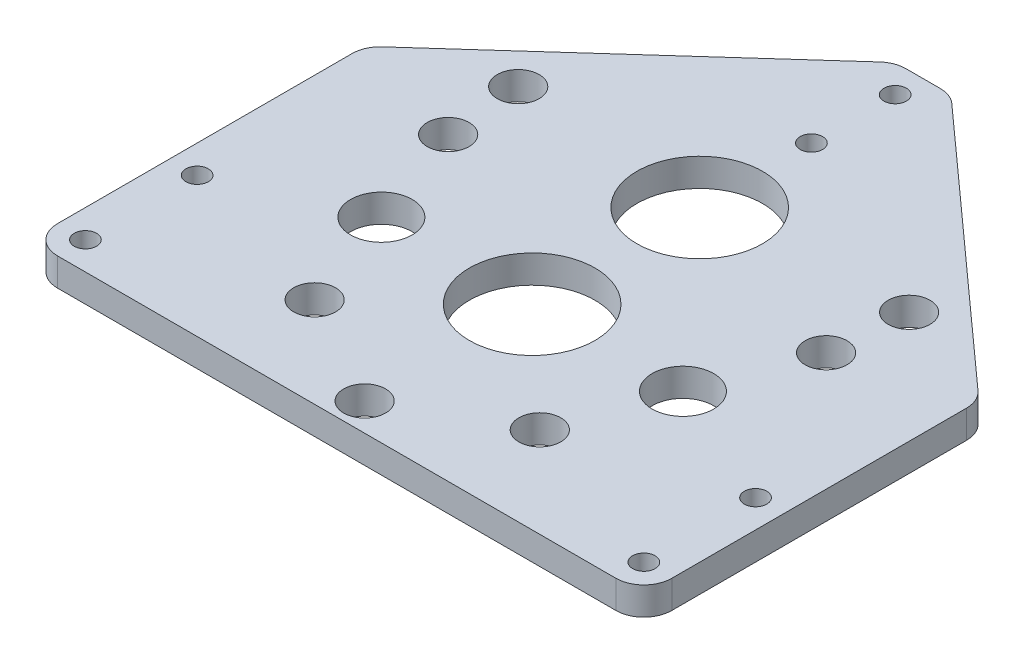
from build123d import *

# Parameters (mm, degrees)
BOSS_EXTRUDE1_DEPTH        = 6.35
SKETCH2_R                  = 7
MOTOR_BEARING_HOLES_DEPTH  = 135.10382172
SKETCH3_R                  = 14.2875
CUT_EXTRUDE1_DEPTH         = 135.10382172
SKETCH4_R                  = 14.2875
CUT_EXTRUDE2_DEPTH         = 135.10382172
SKETCH5_R                  = 4.7625
CUT_EXTRUDE3_DEPTH         = 50.8
F_10_CLEARANCE_HOLE1_D     = 5.1054
F_10_CLEARANCE_HOLE2_D     = 5.1054
F_10_CLEARANCE_HOLE2_DEPTH = 50.8
F_10_CLEARANCE_HOLE2_TIP   = 1.533816902
FILLET1_R                  = 6.35
SKETCH10_R                 = 4.7625
CUT_EXTRUDE4_DEPTH         = 50.8


with BuildPart() as part:
    # Sketch1 → Boss-Extrude1 (new body)
    with BuildSketch(Plane(origin=(0, 0, 0), x_dir=(1, 0, 0), z_dir=(0, 1, 0))):
        Polygon((-69.85, -19.05), (69.85, -19.05), (69.85, 57.15), (6.35, 114.3), (-6.35, 114.3), (-69.85, 57.15), align=None)
    extrude(amount=BOSS_EXTRUDE1_DEPTH)

    # Sketch2 → Motor Bearing Holes (cut, through all)
    with BuildSketch(Plane(origin=(0, 6.35, 0), x_dir=(1, 0, 0), z_dir=(0, 1, 0))):
        with Locations((-34.29, 25.4)):
            Circle(SKETCH2_R)
        with Locations((34.29, 25.4)):
            Circle(SKETCH2_R)
    extrude(amount=-MOTOR_BEARING_HOLES_DEPTH, mode=Mode.SUBTRACT)

    # Sketch3 → Cut-Extrude1 (cut, through all)
    with BuildSketch(Plane(origin=(0, 6.35, 0), x_dir=(1, 0, 0), z_dir=(0, 1, 0))):
        with Locations((0, 25.4)):
            Circle(SKETCH3_R)
    extrude(amount=-CUT_EXTRUDE1_DEPTH, mode=Mode.SUBTRACT)

    # Sketch4 → Cut-Extrude2 (cut, through all)
    with BuildSketch(Plane(origin=(0, 6.35, 0), x_dir=(1, 0, 0), z_dir=(0, 1, 0))):
        with Locations((0, 63.5)):
            Circle(SKETCH4_R)
    extrude(amount=-CUT_EXTRUDE2_DEPTH, mode=Mode.SUBTRACT)

    # Sketch5 → Cut-Extrude3 (cut)
    with BuildSketch(Plane(origin=(0, 38.1, 19.05), x_dir=(-0.9584281674521108, 0, 0.2853339233851958), z_dir=(0, 1, 0))):
        with Locations((21.697168114, -77.740965053)):
            Circle(SKETCH5_R)
        with Locations((18.665649821, -27.031499499)):
            Circle(SKETCH5_R)
        with Locations((-30.411025551, -12.420868461)):
            Circle(SKETCH5_R)
        with Locations((-60.684163962, -53.21519516)):
            Circle(SKETCH5_R)
    extrude(amount=-CUT_EXTRUDE3_DEPTH, mode=Mode.SUBTRACT)

    # #10 Clearance Hole1 (through all)
    with Locations(Plane(origin=(0, 6.35, 19.05), x_dir=(1, 0, 0), z_dir=(0, 1, 0))):
        with Locations((-63.5, 6.35), (63.5, 6.35), (0, 107.95)):
            Hole(F_10_CLEARANCE_HOLE1_D / 2)

    # #10 Clearance Hole2
    with Locations(Plane(origin=(0, 38.1, 19.05), x_dir=(1, 0, 0), z_dir=(0, 1, 0))):
        with Locations((-63.5, 31.75), (63.5, 31.75), (0, 127)):
            Hole(F_10_CLEARANCE_HOLE2_D / 2, depth=F_10_CLEARANCE_HOLE2_DEPTH)
            with Locations((0, 0, -(F_10_CLEARANCE_HOLE2_DEPTH + F_10_CLEARANCE_HOLE2_TIP / 2))):  # 118° drill point
                Cone(0, F_10_CLEARANCE_HOLE2_D / 2, F_10_CLEARANCE_HOLE2_TIP, mode=Mode.SUBTRACT)

    # Fillet1
    fillet1_edges = [part.edges().sort_by_distance(p)[0] for p in [
        (-6.35, 3.175, -114.3),
        (6.35, 3.175, -114.3),
        (69.85, 3.175, -57.15),
        (69.85, 3.175, 19.05),
        (-69.85, 3.175, -57.15),
        (-69.85, 3.175, 19.05),
    ]]
    fillet(fillet1_edges, radius=FILLET1_R)

    # Sketch10 → Cut-Extrude4 (cut)
    with BuildSketch(Plane(origin=(0, -28.575, 19.05), x_dir=(-1, 0, 0), z_dir=(0, -1, 0))):
        with Locations((-44.45, 85.725)):
            Circle(SKETCH10_R)
        with Locations((44.45, 85.725)):
            Circle(SKETCH10_R)
        with Locations((0, 6.35)):
            Circle(SKETCH10_R)
    extrude(amount=-CUT_EXTRUDE4_DEPTH, mode=Mode.SUBTRACT)


solid = part.part
